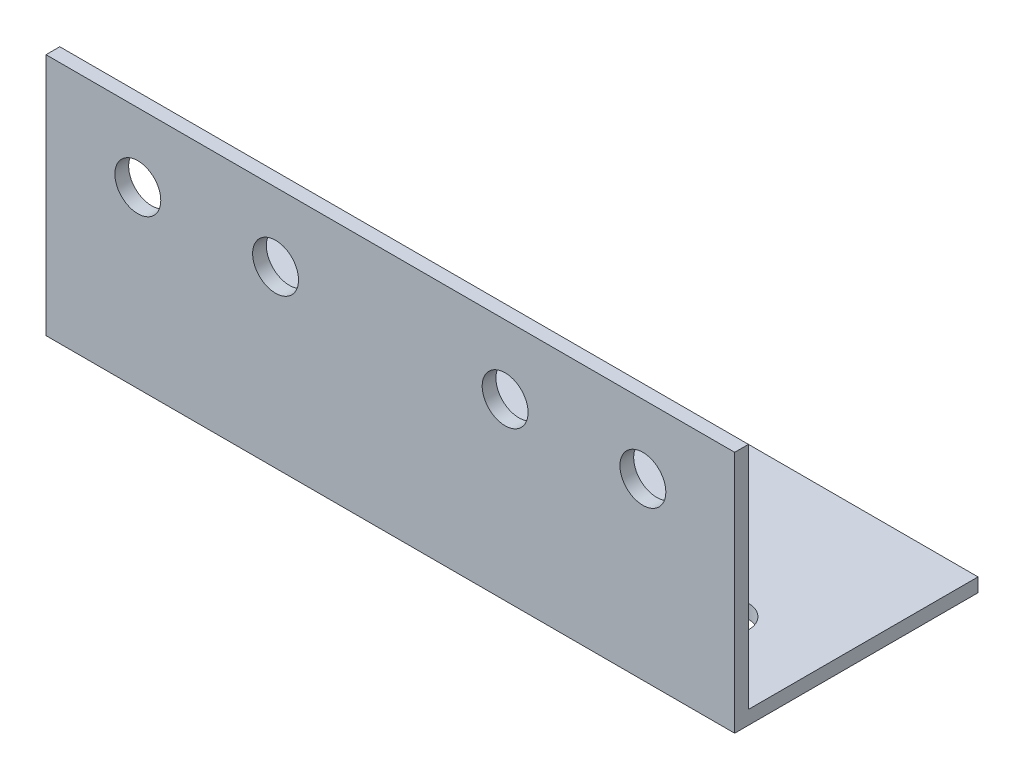
from build123d import *

# Parameters (mm, degrees)
EXTRUDE_1_DEPTH     = 150
SKETCH_2_R          = 5
CUT_EXTRUDE_1_DEPTH = 167.760307028
SKETCH_3_R          = 5
CUT_EXTRUDE_2_DEPTH = 167.760307028


with BuildPart() as part:
    # Эскиз1 → Вытянуть-Тонкостенный1 (new body)
    with BuildSketch(Plane(origin=(0, 0, 0), x_dir=(0, 0, -1), z_dir=(1, 0, 0))):
        Polygon((50, 0), (0, 0), (0, 50), (-3, 50), (-3, -3), (50, -3), align=None)
    extrude(amount=EXTRUDE_1_DEPTH)

    # Эскиз2 → Вырез-Вытянуть1 (cut, through all)
    with BuildSketch(Plane.XY.offset(3)):
        with Locations((20, 35)):
            Circle(SKETCH_2_R)
        with Locations((50, 35)):
            Circle(SKETCH_2_R)
        with Locations((100, 35)):
            Circle(SKETCH_2_R)
        with Locations((130, 35)):
            Circle(SKETCH_2_R)
    extrude(amount=-CUT_EXTRUDE_1_DEPTH, mode=Mode.SUBTRACT)

    # Эскиз3 → Вырез-Вытянуть2 (cut, through all)
    with BuildSketch(Plane.XZ.offset(3)):
        with Locations((130, -15)):
            Circle(SKETCH_3_R)
        with Locations((100, -15)):
            Circle(SKETCH_3_R)
        with Locations((50, -15)):
            Circle(SKETCH_3_R)
        with Locations((20, -15)):
            Circle(SKETCH_3_R)
    extrude(amount=-CUT_EXTRUDE_2_DEPTH, mode=Mode.SUBTRACT)


solid = part.part
